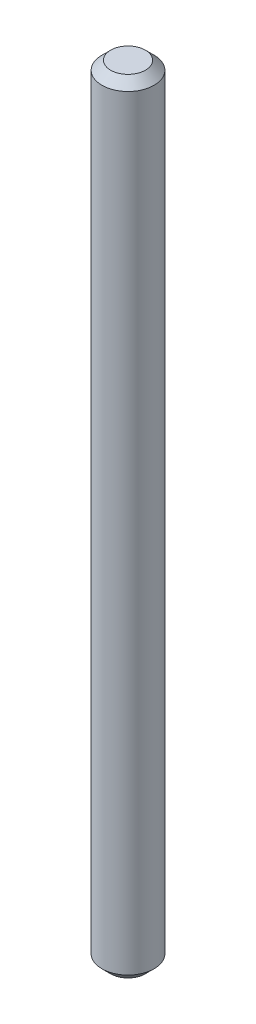
from build123d import *

# Parameters (mm, degrees)
SKETCH1_R           = 3
BOSS_EXTRUDE1_DEPTH = 90
CHAMFER1_SIZE       = 1


with BuildPart() as part:
    # Sketch1 → Boss-Extrude1 (new body)
    with BuildSketch(Plane(origin=(0, 0, 0), x_dir=(1, 0, 0), z_dir=(0, 1, 0))):
        Circle(SKETCH1_R)
    extrude(amount=BOSS_EXTRUDE1_DEPTH)

    # Chamfer1
    chamfer1_edges = [part.edges().sort_by_distance(p)[0] for p in [
        (-3, 0, 0),
        (-3, 90, 0),
    ]]
    chamfer(chamfer1_edges, length=CHAMFER1_SIZE)


solid = part.part
